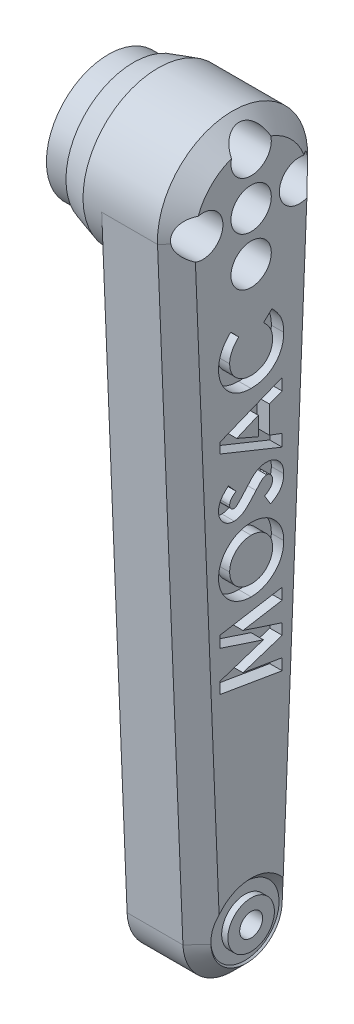
from build123d import *

# Parameters (mm, degrees)
BOSS_EXTRUDE1_DEPTH = 15
BOSS_EXTRUDE2_START = 8
SKETCH2_R           = 12.1
BOSS_EXTRUDE2_DEPTH = 8
SKETCH3_R           = 1.85
TORNILLO_INF_DEPTH  = 110.706016243
SKETCH4_R           = 1.75
TORNILLO_SUP_DEPTH  = 112.082896973
SKETCH6_R           = 12.1
SKETCH6_R_2         = 10
CUT_EXTRUDE4_DEPTH  = 4.05
CUT_EXTRUDE3_START  = -8.8
SKETCH5_R           = 3.25
SKETCH5_R_2         = 1.75
CUT_EXTRUDE3_DEPTH  = 8.8
CUT_EXTRUDE7_REACH  = 113.083
SKETCH5_3_R         = 3.25
CHAMFER2_SIZE       = 3
CHAMFER3_SIZE       = 3
SKETCH11_R          = 5.5
SKETCH11_R_2        = 3.75
CUT_EXTRUDE6_DEPTH  = 1
CHAMFER5_SIZE       = 3.95
CHAMFER5_SIZE_2     = 1.2
MOSAC_RIGHT_DEPTH   = 2


with BuildPart() as part:
    # Sketch1 → Boss-Extrude1 (new body)
    with BuildSketch(Plane(origin=(0, 0, 0), x_dir=(0, -1, 0), z_dir=(-1, 0, 0))):
        with BuildLine():
            Line((0.4961, -12.089825672), (100.328, -7.993273172))
            ThreePointArc((100.328, -7.993273172), (108, 0), (100.328, 7.993273172))
            Line((100.328, 7.993273172), (0.4961, 12.089825672))
            ThreePointArc((0.4961, 12.089825672), (-12.1, 0), (0.4961, -12.089825672))
        make_face()
    extrude(amount=-BOSS_EXTRUDE1_DEPTH)

    # Sketch2 → Boss-Extrude2 (add)
    with BuildSketch(Plane.ZY.offset(BOSS_EXTRUDE2_START)):
        Circle(SKETCH2_R)
    extrude(amount=-BOSS_EXTRUDE2_DEPTH)

    # Sketch3 → Tornillo_inf (cut, through all)
    with BuildSketch(Plane.ZY):
        with Locations(Location((0, -100, 0), (0, 0, 180))):
            Circle(SKETCH3_R)
    extrude(amount=-TORNILLO_INF_DEPTH, mode=Mode.SUBTRACT)

    # Sketch4 → Tornillo_sup (cut, through all)
    with BuildSketch(Plane.ZY.offset(8)):
        with Locations((-7.8, 0)):
            Circle(SKETCH4_R)
        with Locations((0, 7.8)):
            Circle(SKETCH4_R)
        with Locations((7.8, 0)):
            Circle(SKETCH4_R)
        with Locations((0, -7.8)):
            Circle(SKETCH4_R)
    extrude(amount=-TORNILLO_SUP_DEPTH, mode=Mode.SUBTRACT)

    # Sketch6 → Cut-Extrude4 (cut)
    with BuildSketch(Plane.ZY.offset(8)):
        Circle(SKETCH6_R)
        Circle(SKETCH6_R_2, mode=Mode.SUBTRACT)
    extrude(amount=-CUT_EXTRUDE4_DEPTH, mode=Mode.SUBTRACT)

    # Sketch5 → Cut-Extrude3 (cut)
    # profile 1 of 4: a face of its own
    with BuildSketch(Plane(origin=(15, 0, 0), x_dir=(0, 0, -1), z_dir=(1, 0, 0)).offset(CUT_EXTRUDE3_START)):
        with Locations((0, 7.8)):
            Circle(SKETCH5_R)
        with Locations(Location((0, 7.8, 0), (0, 0, 180))):
            Circle(SKETCH5_R_2, mode=Mode.SUBTRACT)
    # profile 2 of 4: a face of its own
    with BuildSketch(Plane(origin=(15, 0, 0), x_dir=(0, 0, -1), z_dir=(1, 0, 0)).offset(CUT_EXTRUDE3_START)):
        with Locations((7.8, 0)):
            Circle(SKETCH5_R)
        with Locations(Location((7.8, 0, 0), (0, 0, 180))):
            Circle(SKETCH5_R_2, mode=Mode.SUBTRACT)
    # profile 3 of 4: a face of its own
    with BuildSketch(Plane(origin=(15, 0, 0), x_dir=(0, 0, -1), z_dir=(1, 0, 0)).offset(CUT_EXTRUDE3_START)):
        with Locations((0, -7.8)):
            Circle(SKETCH5_R)
        with Locations(Location((0, -7.8, 0), (0, 0, 180))):
            Circle(SKETCH5_R_2, mode=Mode.SUBTRACT)
    # profile 4 of 4: a face of its own
    with BuildSketch(Plane(origin=(15, 0, 0), x_dir=(0, 0, -1), z_dir=(1, 0, 0)).offset(CUT_EXTRUDE3_START)):
        with Locations((-7.8, 0)):
            Circle(SKETCH5_R)
        with Locations(Location((-7.8, 0, 0), (0, 0, 180))):
            Circle(SKETCH5_R_2, mode=Mode.SUBTRACT)
    extrude(amount=CUT_EXTRUDE3_DEPTH, mode=Mode.SUBTRACT)

    # Sketch5<3> → Cut-Extrude7 (cut, up to next)
    with BuildSketch(Plane(origin=(15, 0, 0), x_dir=(0, 0, -1), z_dir=(1, 0, 0)), mode=Mode.PRIVATE) as cut_extrude7_sk1:
        Circle(SKETCH5_3_R)
    cut_extrude7_tool1 = extrude(cut_extrude7_sk1.sketch, amount=-CUT_EXTRUDE7_REACH, mode=Mode.PRIVATE) & part.part
    add(cut_extrude7_tool1.solids().sort_by_distance((15, 0, 0))[0], mode=Mode.SUBTRACT)

    # Chamfer2
    # the kernel refuses this chamfer: 3 mm, written as the material it takes off along each edge
    with BuildSketch(Plane(origin=(0, -100.328, 7.993273172), x_dir=(1, 0, 0), z_dir=(0, 0.9991591464826812, 0.041000000000000016))) as chamfer2_piece_1_section:
        Polygon((CHAMFER2_SIZE, 0), (0, CHAMFER2_SIZE), (0, 0), align=None)
    chamfer2_piece_1 = extrude(amount=113.031497887, mode=Mode.PRIVATE)
    chamfer2_piece_1 = chamfer2_piece_1 - Plane(origin=(0, 0, 0), x_dir=(0, -0.041000000000000016, 0.9991591464826812), z_dir=(-1, 0, 0)) * Cylinder(12.1, 239, mode=Mode.PRIVATE)
    add(chamfer2_piece_1, mode=Mode.SUBTRACT)
    with BuildSketch(Plane(origin=(0, -100, 0), x_dir=(0, -0.041000000000003894, -0.9991591464826811), z_dir=(0, 0.9991591464826811, -0.041000000000003894))) as chamfer2_piece_2:
        Polygon((8, -CHAMFER2_SIZE), (8 - CHAMFER2_SIZE, 0), (8, 0), align=None)
    revolve(axis=Axis((0, -100, 0), (-1, 0, 0)), revolution_arc=175.300428789, mode=Mode.SUBTRACT)
    with BuildSketch(Plane(origin=(0, 12.608454954, -12.627564585), x_dir=(0, 0.040999999999999995, 0.9991591464826812), z_dir=(0, -0.9991591464826812, 0.041))) as chamfer2_piece_3_section:
        Polygon((CHAMFER2_SIZE, 0), (0, -CHAMFER2_SIZE), (0, 0), align=None)
    chamfer2_piece_3 = extrude(amount=113.031497887, mode=Mode.PRIVATE)
    chamfer2_piece_3 = chamfer2_piece_3 - Plane(origin=(0, 0, 0), x_dir=(0, -0.041000000000000016, 0.9991591464826812), z_dir=(-1, 0, 0)) * Cylinder(12.1, 239, mode=Mode.PRIVATE)
    add(chamfer2_piece_3, mode=Mode.SUBTRACT)

    # Chamfer3
    # the kernel refuses this chamfer: 3 mm, written as the material it takes off along each edge
    with BuildSketch(Plane(origin=(15, -100, 0), x_dir=(0, -0.041000000000003894, -0.9991591464826811), z_dir=(0, 0.9991591464826811, -0.041000000000003894))) as chamfer3_piece_1:
        Polygon((8 - CHAMFER3_SIZE, 0), (8, CHAMFER3_SIZE), (8, 0), align=None)
    revolve(axis=Axis((15, -100, 0), (-1, 0, 0)), revolution_arc=175.300428789, mode=Mode.SUBTRACT)
    with BuildSketch(Plane(origin=(15, -100.328, 7.993273172), x_dir=(0, 0.041000000000000016, -0.9991591464826812), z_dir=(0, 0.9991591464826812, 0.041000000000000016))) as chamfer3_piece_2:
        Polygon((CHAMFER3_SIZE, 0), (0, CHAMFER3_SIZE), (0, 0), align=None)
    extrude(amount=99.915914648, mode=Mode.SUBTRACT)
    with BuildSketch(Plane(origin=(15, 0, 0), x_dir=(0, -0.041000000000000016, 0.9991591464826812), z_dir=(0, -0.9991591464826812, -0.041000000000000016))) as chamfer3_piece_3:
        Polygon((12.1, CHAMFER3_SIZE), (12.1 - CHAMFER3_SIZE, 0), (12.1, 0), align=None)
    revolve(axis=Axis((15, 0, 0), (-1, 0, 0)), revolution_arc=184.699571211, mode=Mode.SUBTRACT)
    with BuildSketch(Plane(origin=(15, -0.4961, -12.089825672), x_dir=(-1, 0, 0), z_dir=(0, -0.9991591464826812, 0.041))) as chamfer3_piece_4:
        Polygon((CHAMFER3_SIZE, 0), (0, -CHAMFER3_SIZE), (0, 0), align=None)
    extrude(amount=99.915914648, mode=Mode.SUBTRACT)

    # Sketch11 → Cut-Extrude6 (cut)
    with BuildSketch(Plane(origin=(15, 0, 0), x_dir=(0, 0, -1), z_dir=(1, 0, 0))):
        with Locations((0, -100)):
            Circle(SKETCH11_R)
        with Locations((0, -100)):
            Circle(SKETCH11_R_2, mode=Mode.SUBTRACT)
    cut_extrude6 = extrude(amount=-CUT_EXTRUDE6_DEPTH, mode=Mode.SUBTRACT)

    # Mirror1: Cut-Extrude6 across plane
    add(cut_extrude6.mirror(Plane.ZY.offset(-7.5)), mode=Mode.SUBTRACT)

    # Chamfer4: read off the stored shape, not the designer's step
    # Chamfer4 outline → Chamfer4 (revolve, cut)
    with BuildSketch(Plane(origin=(0, -100, 0), x_dir=(0, 1, 0), z_dir=(0, 0, -1))):
        Polygon((5.5, 15), (5.5, 14), (6.5, 15), align=None)
        Polygon((6.5, 0), (5.5, 1), (5.5, 0), align=None)
    revolve(axis=Axis((0, -100, 0), (1, 0, 0)), mode=Mode.SUBTRACT)

    # Chamfer5
    # the kernel refuses this chamfer: 3.95, 1.2 mm, written as the material it takes off along each edge
    with BuildSketch(Plane(origin=(-3.95, 0, 0), x_dir=(0, 0, 1), z_dir=(0, -1, 0))) as chamfer5_piece_1:
        Polygon((12.1, -CHAMFER5_SIZE), (12.1 - CHAMFER5_SIZE_2, 0), (12.1, 0), align=None)
    revolve(axis=Axis((-3.95, 0, 0), (-1, 0, 0)), mode=Mode.SUBTRACT)

    # Sketch9 → MOSAC_right (cut)
    # profile 1 of 5: a face of its own
    with BuildSketch(Plane(origin=(15, 0, 0), x_dir=(0, 0, -1), z_dir=(1, 0, 0))):
        with BuildLine():
            Line((-3.265224359, -15.641025641), (-2.007211538, -16.95713141))
            add(Edge.make_bspline(
                [(-2.007211538, -16.95713141), (-2.122670398, -17.068763826), (-2.348197722, -17.286816907), (-2.646445689, -17.638360029), (-2.896039484, -18.003018088), (-3.102028707, -18.377152323), (-3.264159895, -18.761494968), (-3.378804441, -19.157335015), (-3.449477952, -19.564094076), (-3.457502386, -19.839462049), (-3.461538462, -19.977964744)],
                knots=[0, 0, 0, 0, 1.115315123, 2.178559852, 3.196385012, 4.180486591, 5.141138664, 6.08807191, 7.038351522, 8, 8, 8, 8], degree=3))
            add(Edge.make_bspline(
                [(-3.461538462, -19.977964744), (-3.458340396, -20.093626948), (-3.452029365, -20.321873564), (-3.405651796, -20.656967742), (-3.327082201, -20.977624173), (-3.217871035, -21.284097259), (-3.080337556, -21.577902235), (-2.90746789, -21.856303257), (-2.705031769, -22.120796478), (-2.473383434, -22.368291517), (-2.218417825, -22.591726), (-1.949893333, -22.793043645), (-1.663060411, -22.95979365), (-1.36210196, -23.095911492), (-1.046909305, -23.20317548), (-0.717498223, -23.279305037), (-0.37312496, -23.323414553), (-0.139014085, -23.329990993), (-0.020032051, -23.333333333)],
                knots=[0, 0, 0, 0, 1.035268443, 2.04298821, 3.02163646, 3.985902049, 4.951223231, 5.920091634, 6.913651787, 7.92868536, 8.949353712, 9.945284791, 10.92850487, 11.913014323, 12.897904816, 13.904240668, 14.934873455, 16, 16, 16, 16], degree=3))
            add(Edge.make_bspline(
                [(-0.020032051, -23.333333333), (0.063474991, -23.33235513), (0.228069088, -23.330427071), (0.470931174, -23.309896989), (0.707046168, -23.275707578), (0.935846594, -23.228081492), (1.157631207, -23.167028798), (1.372919337, -23.096502415), (1.579144107, -23.00642222), (1.780166807, -22.907335194), (1.97114841, -22.79333868), (2.152214652, -22.668512149), (2.323406062, -22.534006), (2.484113945, -22.388023888), (2.632024799, -22.228727581), (2.771166034, -22.059964327), (2.899342845, -21.880057594), (3.014514105, -21.688935276), (3.121865929, -21.492380945), (3.210763566, -21.286345345), (3.290678247, -21.076591677), (3.350797897, -20.859438602), (3.403089354, -20.638711676), (3.435025359, -20.411338473), (3.459292504, -20.179476881), (3.460786586, -20.022770462), (3.461538462, -19.943910256)],
                knots=[0, 0, 0, 0, 1.103738238, 2.175490744, 3.219137561, 4.256155604, 5.262629953, 6.259184223, 7.247888397, 8.234817694, 9.220364322, 10.185094651, 11.140491148, 12.096499151, 13.05201798, 14.011605636, 14.986460005, 15.968997565, 16.960259839, 17.944382265, 18.933125845, 19.924977513, 20.920749559, 21.929466621, 22.958034467, 24, 24, 24, 24], degree=3))
            add(Edge.make_bspline(
                [(3.461538462, -19.943910256), (3.457684031, -19.81014541), (3.450111076, -19.547332269), (3.39045925, -19.161708182), (3.293379843, -18.793654423), (3.175427434, -18.500643614), (3.061055847, -18.270945977), (2.9582409, -18.094614001), (2.839711638, -17.914207467), (2.704975877, -17.730001121), (2.554622348, -17.540925796), (2.385713195, -17.350110431), (2.203708052, -17.152731266), (2.073811768, -17.023427728), (2.007211538, -16.95713141)],
                knots=[0, 0, 0, 0, 1.404693586, 2.759857621, 4.088769373, 5.395275838, 6.0697462, 6.783214465, 7.53810233, 8.336454657, 9.18000028, 10.074808326, 11.012918585, 12, 12, 12, 12], degree=3))
            Line((2.007211538, -16.95713141), (3.347355769, -15.681089744))
            add(Edge.make_bspline(
                [(3.347355769, -15.681089744), (3.433957203, -15.770788604), (3.602984682, -15.945861598), (3.84298793, -16.209954348), (4.058657528, -16.473714728), (4.257821337, -16.730770835), (4.434677233, -16.985333516), (4.589401843, -17.237375776), (4.725908376, -17.484044387), (4.841894718, -17.7304615), (4.940379168, -17.978160451), (5.025167815, -18.233013563), (5.09689596, -18.495799945), (5.154771154, -18.768124578), (5.201179245, -19.047447383), (5.232504439, -19.33638245), (5.253563324, -19.633097788), (5.255455639, -19.834364399), (5.256410256, -19.935897436)],
                knots=[0, 0, 0, 0, 1.244526981, 2.429050516, 3.560637417, 4.644440555, 5.67424972, 6.652764056, 7.595344123, 8.486817594, 9.369275933, 10.254498637, 11.166417451, 12.086725134, 13.032340136, 13.991389299, 14.986715468, 16, 16, 16, 16], degree=3))
            add(Edge.make_bspline(
                [(5.256410256, -19.935897436), (5.251655907, -20.122401047), (5.242352968, -20.487336773), (5.173424486, -21.022140563), (5.057867099, -21.530189808), (4.894437081, -22.012720496), (4.685662892, -22.469579194), (4.42971554, -22.900649023), (4.127275036, -23.305235195), (3.781886277, -23.68006945), (3.400433388, -24.019124872), (2.990857633, -24.318810601), (2.551146098, -24.566710647), (2.087794725, -24.772547397), (1.598689064, -24.933509028), (1.08330005, -25.046798729), (0.542125324, -25.116663661), (0.172490511, -25.124306984), (-0.016025641, -25.128205128)],
                knots=[0, 0, 0, 0, 1.078019885, 2.10938526, 3.111377082, 4.085535484, 5.04941344, 6.010039228, 6.978205633, 7.964457913, 8.951525778, 9.924444315, 10.892603023, 11.863865945, 12.85144698, 13.863884204, 14.910567087, 16, 16, 16, 16], degree=3))
            add(Edge.make_bspline(
                [(-0.016025641, -25.128205128), (-0.138977219, -25.126574198), (-0.382637196, -25.123342092), (-0.742174993, -25.088735451), (-1.09222087, -25.041730476), (-1.429783559, -24.964515279), (-1.75870541, -24.874749197), (-2.076075658, -24.759098917), (-2.383231183, -24.624736199), (-2.679784053, -24.471318919), (-2.962531891, -24.295602499), (-3.233277873, -24.10429402), (-3.488514775, -23.89275375), (-3.729294905, -23.663122748), (-3.958345513, -23.417522992), (-4.170033485, -23.151748265), (-4.370037908, -22.870331254), (-4.552393868, -22.571322534), (-4.718243478, -22.261535606), (-4.860928314, -21.942475764), (-4.983357132, -21.618256186), (-5.084153228, -21.287893792), (-5.159595852, -20.95080443), (-5.216647963, -20.609246813), (-5.248552504, -20.26035424), (-5.253774319, -20.026101683), (-5.256410256, -19.907852564)],
                knots=[0, 0, 0, 0, 1.071814294, 2.12407397, 3.147667899, 4.14936388, 5.141177959, 6.119239245, 7.091825145, 8.063277363, 9.028022524, 9.992609517, 10.952139039, 11.915934802, 12.892469547, 13.878248468, 14.87668965, 15.901326483, 16.93027266, 17.938917451, 18.9468897, 19.950817235, 20.948103127, 21.957084021, 22.968749718, 24, 24, 24, 24], degree=3))
            add(Edge.make_bspline(
                [(-5.256410256, -19.907852564), (-5.254897705, -19.806974508), (-5.251888328, -19.606267247), (-5.226846238, -19.307372217), (-5.187406226, -19.01090033), (-5.12831547, -18.717756918), (-5.056753843, -18.426623729), (-4.968609238, -18.138719663), (-4.861093479, -17.854838622), (-4.74215836, -17.572519584), (-4.606756902, -17.297392981), (-4.455201501, -17.031849849), (-4.291456992, -16.77523222), (-4.112706943, -16.529087071), (-3.921576961, -16.291680697), (-3.718073371, -16.063266406), (-3.498504671, -15.846036006), (-3.343377572, -15.7097079), (-3.265224359, -15.641025641)],
                knots=[0, 0, 0, 0, 0.996333415, 1.982307736, 2.96084097, 3.949129141, 4.93457382, 5.921430247, 6.92116383, 7.931890485, 8.946633814, 9.948019707, 10.950686436, 11.952094051, 12.951305284, 13.960287133, 14.972390273, 16, 16, 16, 16], degree=3))
        make_face()
    # profile 2 of 5: a face of its own
    with BuildSketch(Plane(origin=(15, 0, 0), x_dir=(0, 0, -1), z_dir=(1, 0, 0))):
        Polygon((-5, -31.79286859), (-5, -30.128205128), (5, -26.08974359), (5, -28.006810897), (2.948717949, -28.784054487), (2.948717949, -33.141025641), (5, -33.918269231), (5, -35.833333333), align=None)
        Polygon((-2.317708333, -30.961538462), (1.153846154, -32.459935897), (1.153846154, -29.463141026), align=None, mode=Mode.SUBTRACT)
    # profile 3 of 5: a face of its own
    with BuildSketch(Plane(origin=(15, 0, 0), x_dir=(0, 0, -1), z_dir=(1, 0, 0))):
        with BuildLine():
            Line((-3.663862179, -36.923076923), (-2.435897436, -38.265224359))
            add(Edge.make_bspline(
                [(-2.435897436, -38.265224359), (-2.516995655, -38.3227162), (-2.672692925, -38.433092518), (-2.881175241, -38.612001016), (-3.059026171, -38.79010165), (-3.205502736, -38.969044415), (-3.319714983, -39.150415391), (-3.400578516, -39.333899745), (-3.451984231, -39.518457252), (-3.45838548, -39.642451408), (-3.461538462, -39.703525641)],
                knots=[0, 0, 0, 0, 1.299362458, 2.494594718, 3.587462134, 4.587049575, 5.512617175, 6.380583204, 7.202344345, 8, 8, 8, 8], degree=3))
            add(Edge.make_bspline(
                [(-3.461538462, -39.703525641), (-3.45959999, -39.760522053), (-3.45585731, -39.870567149), (-3.416783301, -40.026713875), (-3.353641804, -40.167038087), (-3.2664219, -40.287801928), (-3.162256026, -40.384953812), (-3.051366369, -40.460495203), (-2.930460129, -40.504392453), (-2.847540513, -40.510029728), (-2.806490385, -40.512820513)],
                knots=[0, 0, 0, 0, 1.184157716, 2.286297433, 3.324836695, 4.370048774, 5.362957217, 6.276446515, 7.146738784, 8, 8, 8, 8], degree=3))
            add(Edge.make_bspline(
                [(-2.806490385, -40.512820513), (-2.764867563, -40.51105395), (-2.681044985, -40.507496337), (-2.558192557, -40.47313464), (-2.438151434, -40.421341752), (-2.36507669, -40.371851532), (-2.327724359, -40.346554487)],
                knots=[0, 0, 0, 0, 0.967525499, 1.948461899, 2.951351359, 4, 4, 4, 4], degree=3))
            add(Edge.make_bspline(
                [(-2.327724359, -40.346554487), (-2.298773648, -40.323467376), (-2.231747876, -40.270016822), (-2.123989566, -40.171101202), (-1.996621727, -40.04194101), (-1.846997936, -39.885746014), (-1.673697601, -39.703061091), (-1.479615566, -39.491053998), (-1.266639437, -39.248175725), (-1.116492345, -39.077822416), (-1.037660256, -38.98838141)],
                knots=[0, 0, 0, 0, 0.473854981, 1.097054127, 1.870604305, 2.795416232, 3.865517794, 5.093525133, 6.47400653, 8, 8, 8, 8], degree=3))
            add(Edge.make_bspline(
                [(-1.037660256, -38.98838141), (-0.964880502, -38.904243663), (-0.826759647, -38.744567698), (-0.630396888, -38.517668445), (-0.454526992, -38.316963476), (-0.297832993, -38.144278123), (-0.166767748, -37.99445214), (-0.053267944, -37.874111984), (0.037701295, -37.778107347), (0.092709732, -37.723587963), (0.116185897, -37.700320513)],
                knots=[0, 0, 0, 0, 1.543627419, 2.929484142, 4.163674036, 5.24627963, 6.164986907, 6.925413438, 7.541394495, 8, 8, 8, 8], degree=3))
            add(Edge.make_bspline(
                [(0.116185897, -37.700320513), (0.211733122, -37.612044602), (0.395408443, -37.442347299), (0.679975362, -37.221665515), (0.957525594, -37.040836138), (1.232594987, -36.899311887), (1.511534608, -36.79340993), (1.800360209, -36.7192166), (2.101264754, -36.674106208), (2.306200839, -36.66916559), (2.409855769, -36.666666667)],
                knots=[0, 0, 0, 0, 1.206593015, 2.319495511, 3.336910718, 4.276265636, 5.184178927, 6.099356736, 7.038670786, 8, 8, 8, 8], degree=3))
            add(Edge.make_bspline(
                [(2.409855769, -36.666666667), (2.510851259, -36.668456682), (2.709008167, -36.671968758), (2.998981296, -36.714984948), (3.276498131, -36.776323526), (3.538539053, -36.871163672), (3.789404813, -36.986754471), (4.025189841, -37.131663515), (4.248272334, -37.301841986), (4.454695065, -37.496882459), (4.641919285, -37.712658472), (4.808922891, -37.943958714), (4.945710144, -38.193930913), (5.062856754, -38.457596414), (5.146220452, -38.739769016), (5.21180528, -39.035305957), (5.250228899, -39.347279021), (5.254320117, -39.560526379), (5.256410256, -39.669471154)],
                knots=[0, 0, 0, 0, 1.043169307, 2.046737005, 3.02462096, 3.976528701, 4.921503154, 5.875710796, 6.831116189, 7.817539083, 8.805892356, 9.780872653, 10.7604363, 11.74661763, 12.757588865, 13.796088471, 14.874055702, 16, 16, 16, 16], degree=3))
            add(Edge.make_bspline(
                [(5.256410256, -39.669471154), (5.254894093, -39.75499807), (5.251891221, -39.924390414), (5.227340535, -40.174041019), (5.187804518, -40.415137938), (5.130836659, -40.64726533), (5.059639183, -40.872239293), (4.968748943, -41.087866825), (4.864261805, -41.295697547), (4.74393265, -41.495304242), (4.604100618, -41.685428196), (4.450239656, -41.87139756), (4.274895994, -42.047086541), (4.081473928, -42.216432453), (3.868787191, -42.377250006), (3.640063154, -42.535029759), (3.390981258, -42.682696067), (3.216251359, -42.773918452), (3.127003205, -42.820512821)],
                knots=[0, 0, 0, 0, 1.016956594, 2.014157282, 2.980233409, 3.920138626, 4.854357287, 5.783465618, 6.699725051, 7.61900777, 8.551402113, 9.504102091, 10.486778735, 11.499758944, 12.559144124, 13.656050795, 14.802762778, 16, 16, 16, 16], degree=3))
            Line((3.127003205, -42.820512821), (2.179487179, -41.241987179))
            add(Edge.make_bspline(
                [(2.179487179, -41.241987179), (2.28079579, -41.183704863), (2.475013056, -41.071972682), (2.735968567, -40.882632056), (2.959433767, -40.68866225), (3.141458893, -40.485578857), (3.284477855, -40.275851295), (3.386689127, -40.058466531), (3.449957789, -39.833271834), (3.457684354, -39.679879437), (3.461538462, -39.603365385)],
                knots=[0, 0, 0, 0, 1.283663364, 2.460892379, 3.537111102, 4.529833553, 5.449777664, 6.316464042, 7.160231139, 8, 8, 8, 8], degree=3))
            add(Edge.make_bspline(
                [(3.461538462, -39.603365385), (3.458390988, -39.525539639), (3.452284432, -39.374546358), (3.395880012, -39.159022771), (3.307320934, -38.961422586), (3.180959342, -38.790618446), (3.035118859, -38.645992269), (2.872864653, -38.539249848), (2.69730952, -38.47219354), (2.575357376, -38.465104063), (2.514022436, -38.461538462)],
                knots=[0, 0, 0, 0, 1.13588714, 2.203786484, 3.234766741, 4.283437687, 5.291419208, 6.222934724, 7.106237994, 8, 8, 8, 8], degree=3))
            add(Edge.make_bspline(
                [(2.514022436, -38.461538462), (2.456960255, -38.464831148), (2.341043897, -38.471519926), (2.168694913, -38.520787399), (1.99642431, -38.597807488), (1.8551233, -38.688927685), (1.736815795, -38.781653894), (1.634307694, -38.870321065), (1.521054187, -38.978294224), (1.396912812, -39.105299598), (1.26079072, -39.249659116), (1.11270124, -39.411494381), (0.953948864, -39.592658579), (0.845808314, -39.720705791), (0.789262821, -39.787660256)],
                knots=[0, 0, 0, 0, 0.916159276, 1.861089862, 2.860218735, 3.940849679, 4.552606315, 5.27541173, 6.11797699, 7.06649574, 8.129236253, 9.306560635, 10.591630461, 12, 12, 12, 12], degree=3))
            add(Edge.make_bspline(
                [(0.789262821, -39.787660256), (0.681569185, -39.914943467), (0.474872501, -40.159238475), (0.169586796, -40.504456619), (-0.115726414, -40.815535036), (-0.384612677, -41.089760965), (-0.632047317, -41.330712197), (-0.860226964, -41.536493808), (-1.070758671, -41.70600298), (-1.321791003, -41.881952339), (-1.624971142, -42.051154693), (-1.989500962, -42.197668112), (-2.354351525, -42.291829928), (-2.599628857, -42.302460177), (-2.720352564, -42.307692308)],
                knots=[0, 0, 0, 0, 1.345561566, 2.582539916, 3.71901348, 4.751744315, 5.681651107, 6.506005906, 7.230637833, 7.861516384, 8.978504332, 10.023243174, 11.027054763, 12, 12, 12, 12], degree=3))
            add(Edge.make_bspline(
                [(-2.720352564, -42.307692308), (-2.805967161, -42.305523139), (-2.974637114, -42.301249643), (-3.222642365, -42.263130738), (-3.461944021, -42.206157451), (-3.69168116, -42.123427353), (-3.911520685, -42.016012139), (-4.122711115, -41.885716155), (-4.323035439, -41.729488735), (-4.514464168, -41.555668889), (-4.687609993, -41.361848506), (-4.840349848, -41.155592802), (-4.970052475, -40.937806368), (-5.074168603, -40.707650092), (-5.156816218, -40.467003852), (-5.214714185, -40.215259678), (-5.249330876, -39.952890506), (-5.254021063, -39.774411335), (-5.256410256, -39.68349359)],
                knots=[0, 0, 0, 0, 1.010608097, 1.99100651, 2.956992389, 3.912457524, 4.868345712, 5.842283282, 6.837666818, 7.864758285, 8.892394644, 9.901925088, 10.892014243, 11.880216914, 12.880338321, 13.892361018, 14.926363314, 16, 16, 16, 16], degree=3))
            add(Edge.make_bspline(
                [(-5.256410256, -39.68349359), (-5.252100165, -39.565670975), (-5.243514004, -39.330955795), (-5.176369764, -38.983924297), (-5.070787022, -38.644951741), (-4.943385989, -38.371822721), (-4.820034194, -38.154448374), (-4.706284099, -37.988005034), (-4.576473449, -37.817650061), (-4.426943603, -37.646020341), (-4.262599215, -37.468949596), (-4.079652016, -37.289053858), (-3.879984047, -37.104416827), (-3.737164842, -36.984582489), (-3.663862179, -36.923076923)],
                knots=[0, 0, 0, 0, 1.282949271, 2.555771389, 3.837399776, 5.142782039, 5.830402679, 6.558840402, 7.337330299, 8.162747002, 9.037840561, 9.968992266, 10.957575255, 12, 12, 12, 12], degree=3))
        make_face()
    # profile 4 of 5: a face of its own
    with BuildSketch(Plane(origin=(15, 0, 0), x_dir=(0, 0, -1), z_dir=(1, 0, 0))):
        with BuildLine():
            add(Edge.make_bspline(
                [(-5.256410256, -49.018429487), (-5.251907775, -48.84456777), (-5.243018858, -48.501325362), (-5.168949834, -47.996530315), (-5.048197682, -47.510103166), (-4.880581642, -47.042092129), (-4.660670104, -46.594623488), (-4.398546843, -46.163336098), (-4.082818236, -45.753692452), (-3.724729187, -45.367107798), (-3.335069477, -45.009947248), (-2.915545991, -44.700546389), (-2.47668579, -44.435977586), (-2.016825689, -44.218320326), (-1.534397861, -44.051130011), (-1.031412607, -43.934318888), (-0.507733702, -43.859177697), (-0.151168784, -43.850542506), (0.030048077, -43.846153846)],
                knots=[0, 0, 0, 0, 1.014235534, 2.002330665, 2.970116157, 3.9352621, 4.897279957, 5.875024536, 6.875755618, 7.909865842, 8.947091691, 9.955591861, 10.946663836, 11.933282567, 12.91916997, 13.920121047, 14.942943865, 16, 16, 16, 16], degree=3))
            add(Edge.make_bspline(
                [(0.030048077, -43.846153846), (0.209222483, -43.850829097), (0.562291399, -43.860041829), (1.081152398, -43.931236763), (1.578720248, -44.050089684), (2.056006308, -44.213989114), (2.510603863, -44.428079025), (2.944410473, -44.688121295), (3.35593834, -44.99685528), (3.743453404, -45.34688369), (4.097598256, -45.729848741), (4.407649228, -46.137738391), (4.670313656, -46.565691591), (4.886615815, -47.013373172), (5.049783973, -47.484009141), (5.171798855, -47.972286978), (5.242381063, -48.482178034), (5.251686828, -48.828580025), (5.256410256, -49.004407051)],
                knots=[0, 0, 0, 0, 1.051628416, 2.072267533, 3.067761847, 4.050852917, 5.029392597, 6.012272624, 7.015026456, 8.044749159, 9.073964344, 10.072810436, 11.047668484, 12.017263184, 12.98554948, 13.966731695, 14.967951888, 16, 16, 16, 16], degree=3))
            add(Edge.make_bspline(
                [(5.256410256, -49.004407051), (5.252222258, -49.188314896), (5.243993415, -49.549668672), (5.166400989, -50.078642814), (5.048101004, -50.584723447), (4.876831089, -51.066523897), (4.654289681, -51.523669619), (4.385587912, -51.958210717), (4.065535441, -52.366879056), (3.703785592, -52.748312425), (3.307849261, -53.093851726), (2.889604278, -53.398868459), (2.452213582, -53.656154197), (1.995480821, -53.865722158), (1.522242297, -54.030936947), (1.029616428, -54.147477252), (0.518784555, -54.216320381), (0.171817341, -54.22590983), (-0.00400641, -54.230769231)],
                knots=[0, 0, 0, 0, 1.067953136, 2.098381936, 3.099641766, 4.083805132, 5.062469929, 6.048665414, 7.046702845, 8.073106546, 9.098695993, 10.09591865, 11.076726721, 12.041940862, 13.011263376, 13.984305721, 14.978557872, 16, 16, 16, 16], degree=3))
            add(Edge.make_bspline(
                [(-0.00400641, -54.230769231), (-0.122291255, -54.229243625), (-0.357363188, -54.22621173), (-0.705730803, -54.189706598), (-1.047286963, -54.137115899), (-1.380725369, -54.059462585), (-1.708793046, -53.964516989), (-2.028567275, -53.843112764), (-2.34221663, -53.703141644), (-2.646225737, -53.541308436), (-2.937092877, -53.3583553), (-3.217318592, -53.162980138), (-3.47956919, -52.947743624), (-3.726641717, -52.717044516), (-3.957589769, -52.470111669), (-4.172173275, -52.20644728), (-4.372848112, -51.927945191), (-4.556950235, -51.634579792), (-4.719685751, -51.328520933), (-4.865416261, -51.016522336), (-4.985048051, -50.697287459), (-5.083545079, -50.372687158), (-5.162699394, -50.043180186), (-5.215305333, -49.706147564), (-5.251795941, -49.364453841), (-5.254868501, -49.134044667), (-5.256410256, -49.018429487)],
                knots=[0, 0, 0, 0, 1.034634222, 2.056167603, 3.061938024, 4.056975325, 5.049831446, 6.048294015, 7.047371884, 8.053753139, 9.058980286, 10.052730068, 11.041053953, 12.024946181, 13.008838409, 13.997162294, 14.997691456, 16.01096975, 17.025258359, 18.029177048, 19.022170708, 20.005507574, 20.996177714, 21.984639769, 22.988728483, 24, 24, 24, 24], degree=3))
        make_face()
        with BuildLine():
            add(Edge.make_bspline(
                [(-3.461538462, -49.046474359), (-3.45839884, -49.163483634), (-3.452202483, -49.39441312), (-3.404994627, -49.73314462), (-3.329598314, -50.058338823), (-3.220387676, -50.368193047), (-3.081390252, -50.664050229), (-2.913091715, -50.946434832), (-2.709706992, -51.211436412), (-2.482154901, -51.46258851), (-2.228609577, -51.689463103), (-1.956892643, -51.889913963), (-1.667457861, -52.057659046), (-1.362994012, -52.198146605), (-1.04007748, -52.3039026), (-0.701237706, -52.379229424), (-0.345890852, -52.426833165), (-0.103651364, -52.432833676), (0.020032051, -52.435897436)],
                knots=[0, 0, 0, 0, 1.033739768, 2.040188636, 3.016340934, 3.979330865, 4.937572243, 5.900995986, 6.878200029, 7.884839167, 8.891893314, 9.879764717, 10.863503415, 11.843163062, 12.837761627, 13.859916423, 14.907309254, 16, 16, 16, 16], degree=3))
            add(Edge.make_bspline(
                [(0.020032051, -52.435897436), (0.157097138, -52.431826037), (0.425721997, -52.423846771), (0.817651709, -52.36796326), (1.188140075, -52.271499718), (1.535347541, -52.134701772), (1.861229594, -51.961323788), (2.163949811, -51.748960059), (2.4449318, -51.497644898), (2.609023852, -51.304141077), (2.692307692, -51.205929487)],
                knots=[0, 0, 0, 0, 1.078420897, 2.113526272, 3.107597235, 4.084297302, 5.043369457, 6.005430726, 6.9876695, 8, 8, 8, 8], degree=3))
            add(Edge.make_bspline(
                [(2.692307692, -51.205929487), (2.753831519, -51.125468691), (2.875493031, -50.966359895), (3.031427217, -50.712387616), (3.165078369, -50.450846177), (3.273066919, -50.179761922), (3.358008897, -49.899707366), (3.417492368, -49.610720913), (3.45482339, -49.313212032), (3.459285154, -49.112022584), (3.461538462, -49.010416667)],
                knots=[0, 0, 0, 0, 1.023928204, 2.024787132, 3.009472467, 3.9914905, 4.972207045, 5.96565515, 6.972602802, 8, 8, 8, 8], degree=3))
            add(Edge.make_bspline(
                [(3.461538462, -49.010416667), (3.45836756, -48.895421724), (3.45212871, -48.669165558), (3.40556855, -48.336706098), (3.326414552, -48.018355765), (3.218969725, -47.71112496), (3.074813231, -47.419272051), (2.904506576, -47.138154198), (2.699801283, -46.872672165), (2.467454471, -46.622922864), (2.213018166, -46.393844912), (1.941211978, -46.191754892), (1.654564995, -46.021250391), (1.353124634, -45.881834101), (1.037222181, -45.772625033), (0.705889915, -45.698060394), (0.36063741, -45.650093773), (0.125697078, -45.644086151), (0.006009615, -45.641025641)],
                knots=[0, 0, 0, 0, 1.026460056, 2.019592442, 2.989754624, 3.951362471, 4.919177453, 5.890456226, 6.881277895, 7.906300149, 8.932084862, 9.933608786, 10.925308803, 11.904168404, 12.893913482, 13.903284022, 14.931853825, 16, 16, 16, 16], degree=3))
            add(Edge.make_bspline(
                [(0.006009615, -45.641025641), (-0.112993966, -45.644181166), (-0.347234367, -45.650392336), (-0.691537031, -45.697215768), (-1.021019647, -45.77505813), (-1.336531537, -45.885074266), (-1.639729114, -46.02213148), (-1.927980885, -46.194298157), (-2.201037459, -46.397842499), (-2.457275482, -46.629043545), (-2.692757596, -46.880650279), (-2.897109244, -47.15078616), (-3.074685373, -47.43187956), (-3.21379109, -47.730383515), (-3.324616388, -48.040190005), (-3.40622971, -48.363189722), (-3.451870846, -48.700605983), (-3.458287198, -48.930157245), (-3.461538462, -49.046474359)],
                knots=[0, 0, 0, 0, 1.055040155, 2.076685641, 3.074845078, 4.052329834, 5.035358467, 6.020382375, 7.023447318, 8.050688466, 9.077178457, 10.074336316, 11.0503314, 12.019748348, 12.988025369, 13.964577102, 14.968620271, 16, 16, 16, 16], degree=3))
        make_face(mode=Mode.SUBTRACT)
    # profile 5 of 5: a face of its own
    with BuildSketch(Plane(origin=(15, 0, 0), x_dir=(0, 0, -1), z_dir=(1, 0, 0))):
        Polygon((-5, -65.362580128), (-5, -63.499599359), (1.975160256, -61.217948718), (-5, -58.920272436), (-5, -57.075320513), (5, -55.384615385), (5, -57.201522436), (-1.316105769, -58.269230769), (5, -60.348557692), (5, -62.099358974), (-1.316105769, -64.166666667), (5, -65.232371795), (5, -67.051282051), align=None)
    extrude(amount=-MOSAC_RIGHT_DEPTH, mode=Mode.SUBTRACT)


solid = part.part
